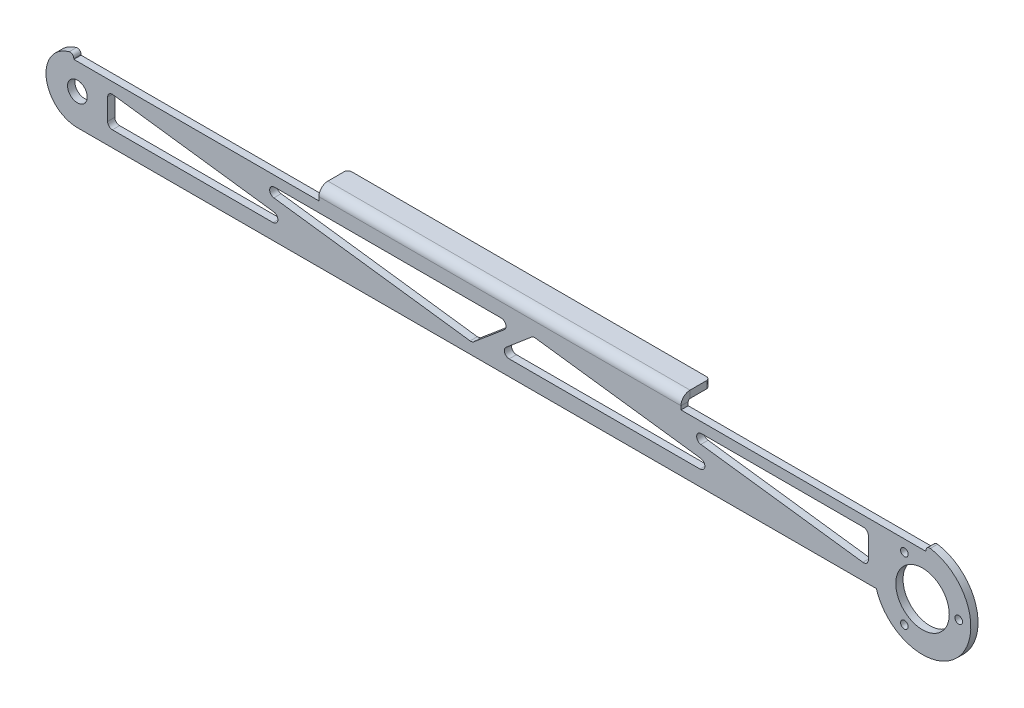
from build123d import *

# Parameters (mm, degrees)
BASE_FLANGE1_DEPTH            = 3
EDGE_FLANGE2_STRIP_W          = 13.4732
EDGE_FLANGE2_STRIP_H          = 3
EDGE_FLANGE2_STRIP_CUT_DEPTH  = 349.93
EDGE_FLANGE2_RELIEF_W         = 14.9732
EDGE_FLANGE2_RELIEF_H         = 1.5
EDGE_FLANGE2_RELIEF_CUT_DEPTH = 3
EDGE_FLANGE2_DEPTH            = 349.93
CUT_EXTRUDE1_DEPTH            = 372.108077115
CUT_EXTRUDE1_DEPTH_BACK       = 372.108077115
SKETCH22_R                    = 4.075
SKETCH22_R_2                  = 11.075
SKETCH22_R_3                  = 1.575
CUT_EXTRUDE2_DEPTH            = 372.108077115
CUT_EXTRUDE2_DEPTH_BACK       = 372.108077115
FILLET1_R                     = 2
CUT_EXTRUDE3_DEPTH            = 372.108077115
CUT_EXTRUDE3_DEPTH_BACK       = 372.108077115
SKETCH24_W                    = 100
SKETCH24_H                    = 5.2366
FILLET2_R                     = 1.5


# Sheet-metal steps are written as plain solids
with BuildPart() as part:
    # Sketch1 → Base-Flange1 (new body)
    with BuildSketch(Plane.XY):
        with BuildLine():
            Line((0, 13), (349.93, 13))
            ThreePointArc((349.93, 13), (366.008670386, -18.89438349), (330.805412842, -12.852364139))
            Line((330.805412842, -12.852364139), (0, -13))
            ThreePointArc((0, -13), (-13, 0), (0, 13))
        make_face()
    extrude(amount=-BASE_FLANGE1_DEPTH)

    # Edge-Flange2 strip (across the edge) → Edge-Flange2 strip cut (cut)
    with BuildSketch(Plane(origin=(0, 13, -3), x_dir=(0, -1, 0), z_dir=(1, 0, 0))):
        with Locations((-6, -1.5)):
            Rectangle(EDGE_FLANGE2_STRIP_W, EDGE_FLANGE2_STRIP_H)
    extrude(amount=EDGE_FLANGE2_STRIP_CUT_DEPTH, mode=Mode.SUBTRACT)

    # Edge-Flange2 relief (on the sheet) → Edge-Flange2 relief cut (cut)
    with BuildSketch(Plane(origin=(0, 12.2634, -3), x_dir=(0, -1, 0), z_dir=(0, 0, -1))):
        with Locations((-5.9866, 0.75)):
            Rectangle(EDGE_FLANGE2_RELIEF_W, EDGE_FLANGE2_RELIEF_H)
        with Locations((-5.9866, -350.68)):
            Rectangle(EDGE_FLANGE2_RELIEF_W, EDGE_FLANGE2_RELIEF_H)
    extrude(amount=-EDGE_FLANGE2_RELIEF_CUT_DEPTH, mode=Mode.SUBTRACT)

    # Edge-Flange2 section (across the edge) → Edge-Flange2 (add)
    with BuildSketch(Plane(origin=(0, 13, -3), x_dir=(0, -1, 0), z_dir=(1, 0, 0))):
        with BuildLine():
            Line((-3, 0.7366), (-3, 9))
            Line((-3, 9), (0, 9))
            Line((0, 9), (0, 0.7366))
            ThreePointArc((0, 0.7366), (0.215745145, 0.215745145), (0.7366, 0))
            Line((0.7366, 0), (0.7366, -3))
            ThreePointArc((0.7366, -3), (-1.905575199, -1.905575199), (-3, 0.7366))
        make_face()
    extrude(amount=EDGE_FLANGE2_DEPTH)

    # Sketch22 → Cut-Extrude1 (cut, two sides: drawn at the far end of the back side and taken through both)
    with BuildSketch(Plane.XY.offset(-CUT_EXTRUDE1_DEPTH_BACK)):
        Circle(SKETCH22_R)
        with Locations((349.93, -7)):
            Circle(SKETCH22_R_2)
        with Locations((364.93, -7)):
            Circle(SKETCH22_R_3)
        with Locations((342.43, 5.990381057)):
            Circle(SKETCH22_R_3)
        with Locations((342.43, -19.990381057)):
            Circle(SKETCH22_R_3)
    extrude(amount=CUT_EXTRUDE1_DEPTH + CUT_EXTRUDE1_DEPTH_BACK, mode=Mode.SUBTRACT)

    # Sketch23 → Cut-Extrude2 (cut, two sides: drawn at the far end of the back side and taken through both)
    with BuildSketch(Plane.XY.offset(-CUT_EXTRUDE2_DEPTH_BACK)):
        Polygon((12.5, 6.5), (12.5, -6.5), (111.651399385, -6.5), align=None)
        Polygon((327.5, 6.5), (227.5, 6.5), (327.5, -6.5), align=None)
        Polygon((50.961538462, 6.5), (163.478075869, -8.252338296), (180.961538462, 6.5), align=None)
        Polygon((173.308112114, -6.5), (288.714823182, -6.5), (188.714823182, 6.5), align=None)
    extrude(amount=CUT_EXTRUDE2_DEPTH + CUT_EXTRUDE2_DEPTH_BACK, mode=Mode.SUBTRACT)

    # Fillet1
    fillet1_edges = [part.edges().sort_by_distance(p)[0] for p in [
        (12.5, 6.5, -1.5),
        (288.714823182, -6.5, -1.5),
        (173.308112114, -6.5, -1.5),
        (188.714823182, 6.5, -1.5),
        (163.478075869, -8.252338296, -1.5),
        (50.961538462, 6.5, -1.5),
        (180.961538462, 6.5, -1.5),
        (227.5, 6.5, -1.5),
        (0, 14.5, -12),
        (349.93, 14.5, -12),
        (327.5, -6.5, -1.5),
        (327.5, 6.5, -1.5),
        (111.651399385, -6.5, -1.5),
        (12.5, -6.5, -1.5),
    ]]
    fillet(fillet1_edges, radius=FILLET1_R)

    # Sketch24 → Cut-Extrude3 (cut, two sides: drawn at the far end of the back side and taken through both)
    with BuildSketch(Plane.XY.offset(-CUT_EXTRUDE3_DEPTH_BACK)):
        with Locations((50, 13.3817)):
            Rectangle(SKETCH24_W, SKETCH24_H)
        with Locations((299.93, 13.3817)):
            Rectangle(SKETCH24_W, SKETCH24_H)
    extrude(amount=CUT_EXTRUDE3_DEPTH + CUT_EXTRUDE3_DEPTH_BACK, mode=Mode.SUBTRACT)

    # Fillet2
    fillet2_edges = [part.edges().sort_by_distance(p)[0] for p in [
        (351.43, 12.943670675, -1.5),
        (-1.5, 12.91317157, -1.5),
        (100, 14.5, -12),
        (249.93, 14.5, -12),
    ]]
    fillet(fillet2_edges, radius=FILLET2_R)


solid = part.part
